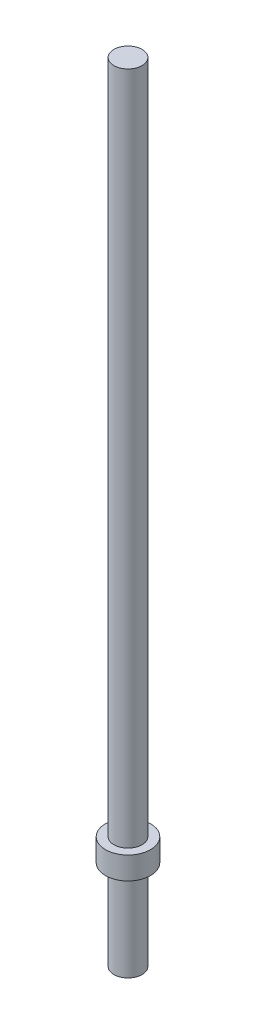
from build123d import *

# Parameters (mm, degrees)
SKETCH1_R           = 2.5
BOSS_EXTRUDE1_DEPTH = 120
SKETCH2_R           = 4
BOSS_EXTRUDE2_DEPTH = 4
BOSS_EXTRUDE3_START = -20
SKETCH3_R           = 2.5
BOSS_EXTRUDE3_DEPTH = 20


with BuildPart() as part:
    # Sketch1 → Boss-Extrude1 (new body)
    with BuildSketch(Plane(origin=(0, 0, 0), x_dir=(1, 0, 0), z_dir=(0, 1, 0))):
        Circle(SKETCH1_R)
    extrude(amount=BOSS_EXTRUDE1_DEPTH)

    # Sketch2 → Boss-Extrude2 (add)
    with BuildSketch(Plane(origin=(0, 0, 0), x_dir=(1, 0, 0), z_dir=(0, 1, 0))):
        Circle(SKETCH2_R)
    extrude(amount=-BOSS_EXTRUDE2_DEPTH)

    # Sketch3 → Boss-Extrude3 (add)
    with BuildSketch(Plane(origin=(0, 0, 0), x_dir=(1, 0, 0), z_dir=(0, 1, 0)).offset(BOSS_EXTRUDE3_START)):
        Circle(SKETCH3_R)
    extrude(amount=BOSS_EXTRUDE3_DEPTH)


solid = part.part
